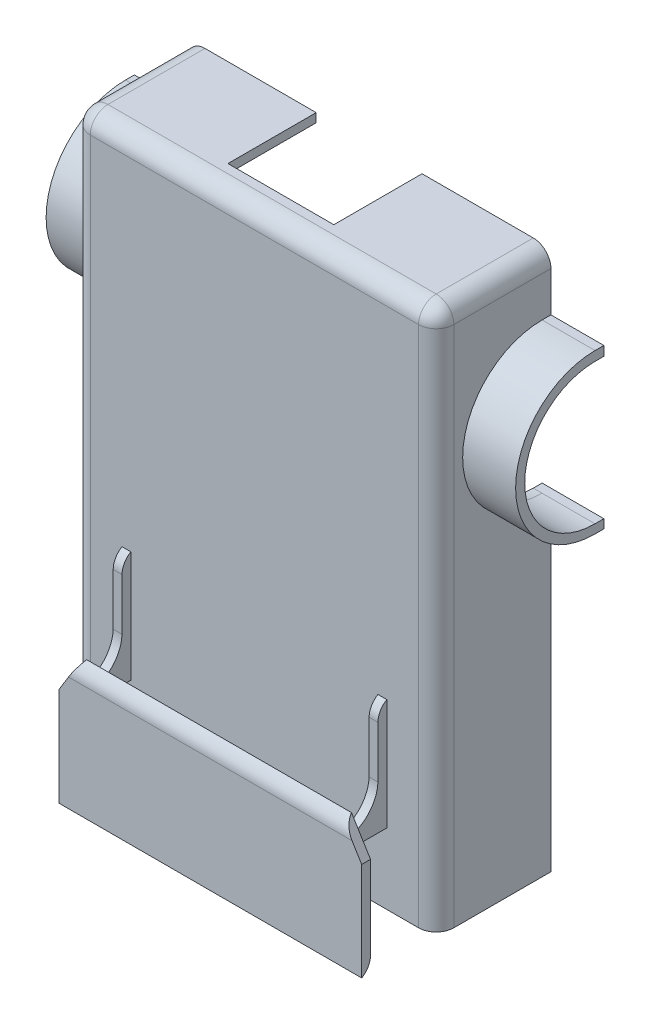
from build123d import *

# Parameters (mm, degrees)
SKETCH1_W               = 206
SKETCH1_H               = 306
BOSS_EXTRUDE2_DEPTH     = 5
SKETCH2_W               = 206
SKETCH2_H               = 306
SKETCH2_W_2             = 196
SKETCH2_H_2             = 296
BOSS_EXTRUDE3_DEPTH     = 60
SKETCH3_W               = 5
SKETCH3_H               = 198
BOSS_EXTRUDE4_DEPTH     = 60
SKETCH10_W              = 60
SKETCH10_H              = 5
CUT_EXTRUDE3_DEPTH      = 50
CUT_EXTRUDE4_DEPTH      = 296.372645991
CUT_EXTRUDE4_DEPTH_BACK = 5
BOSS_EXTRUDE6_DEPTH     = 30
CUT_EXTRUDE5_DEPTH      = 318.025235589
CUT_EXTRUDE5_DEPTH_BACK = 5
BOSS_EXTRUDE7_DEPTH     = 30
SKETCH16_W              = 5
SKETCH16_H              = 63
BOSS_EXTRUDE8_DEPTH     = 5
BOSS_EXTRUDE10_DEPTH    = 150
SKETCH19_W              = 140
SKETCH19_H              = 20
CUT_EXTRUDE6_DEPTH      = 70
BOSS_EXTRUDE11_DEPTH    = 5
FILLET3_R               = 10
FILLET4_R               = 10
FILLET5_R               = 10
FILLET6_R               = 10
FILLET7_R               = 10
FILLET8_R               = 10
FILLET9_R               = 10


with BuildPart() as part:
    # Sketch1 → Boss-Extrude2 (new body)
    with BuildSketch(Plane.XY):
        with Locations((0, 50)):
            Rectangle(SKETCH1_W, SKETCH1_H)
    extrude(amount=BOSS_EXTRUDE2_DEPTH)

    # Sketch2 → Boss-Extrude3 (add)
    with BuildSketch(Plane(origin=(0, 0, 0), x_dir=(-1, 0, 0), z_dir=(0, 0, -1))):
        with Locations((0, 50)):
            Rectangle(SKETCH2_W, SKETCH2_H)
        with Locations((0, 50)):
            Rectangle(SKETCH2_W_2, SKETCH2_H_2, mode=Mode.SUBTRACT)
    extrude(amount=BOSS_EXTRUDE3_DEPTH)

    # Sketch3 → Boss-Extrude4 (add)
    with BuildSketch(Plane(origin=(0, 0, 0), x_dir=(-1, 0, 0), z_dir=(0, 0, -1))):
        with Locations((-52.5, 1)):
            Rectangle(SKETCH3_W, SKETCH3_H)
        with Locations((52.5, 1)):
            Rectangle(SKETCH3_W, SKETCH3_H)
    extrude(amount=BOSS_EXTRUDE4_DEPTH)

    # Sketch10 → Cut-Extrude3 (cut)
    with BuildSketch(Plane(origin=(0, 0, -60), x_dir=(-1, 0, 0), z_dir=(0, 0, -1))):
        with Locations((0, 200.5)):
            Rectangle(SKETCH10_W, SKETCH10_H)
    extrude(amount=-CUT_EXTRUDE3_DEPTH, mode=Mode.SUBTRACT)

    # Sketch11 → Cut-Extrude4 (cut, two sides: drawn at the far end of the back side and taken through both)
    with BuildSketch(Plane(origin=(103, 0, 0), x_dir=(0, 0, -1), z_dir=(1, 0, 0)).offset(-CUT_EXTRUDE4_DEPTH_BACK)):
        with BuildLine():
            Line((55, 165.246993189), (60, 165.246993189))
            Line((60, 165.246993189), (60, 85.246993189))
            Line((60, 85.246993189), (55, 85.246993189))
            ThreePointArc((55, 85.246993189), (15, 125.246993189), (55, 165.246993189))
        make_face()
    extrude(amount=CUT_EXTRUDE4_DEPTH + CUT_EXTRUDE4_DEPTH_BACK, mode=Mode.SUBTRACT)

    # Sketch12 → Boss-Extrude6 (add)
    with BuildSketch(Plane(origin=(103, 0, 0), x_dir=(0, 0, -1), z_dir=(1, 0, 0))):
        with BuildLine():
            Line((55, 170.246993189), (60, 170.246993189))
            Line((60, 170.246993189), (60, 164.922358247))
            Line((60, 164.922358247), (55, 164.922358247))
            ThreePointArc((55, 164.922358247), (15.162317471, 125.084675718), (55, 85.246993189))
            Line((55, 85.246993189), (60, 85.246993189))
            Line((60, 85.246993189), (60, 80.246993189))
            Line((60, 80.246993189), (55, 80.246993189))
            ThreePointArc((55, 80.246993189), (10, 125.246993189), (55, 170.246993189))
        make_face()
    extrude(amount=BOSS_EXTRUDE6_DEPTH)

    # Sketch13 → Cut-Extrude5 (cut, two sides: drawn at the far end of the back side and taken through both)
    with BuildSketch(Plane.ZY.offset(103).offset(-CUT_EXTRUDE5_DEPTH_BACK)):
        with BuildLine():
            Line((-55, 165), (-60, 165))
            Line((-60, 165), (-60, 85))
            Line((-60, 85), (-55, 85))
            ThreePointArc((-55, 85), (-15, 125), (-55, 165))
        make_face()
    extrude(amount=CUT_EXTRUDE5_DEPTH + CUT_EXTRUDE5_DEPTH_BACK, mode=Mode.SUBTRACT)

    # Sketch14 → Boss-Extrude7 (add)
    with BuildSketch(Plane.ZY.offset(103)):
        with BuildLine():
            Line((-55, 170), (-60, 170))
            Line((-60, 170), (-60, 165))
            Line((-60, 165), (-55, 165))
            ThreePointArc((-55, 165), (-15, 125), (-55, 85))
            Line((-55, 85), (-60, 85))
            Line((-60, 85), (-60, 80))
            Line((-60, 80), (-55, 80))
            ThreePointArc((-55, 80), (-10, 125), (-55, 170))
        make_face()
    extrude(amount=BOSS_EXTRUDE7_DEPTH)

    # Sketch16 → Boss-Extrude8 (add)
    with BuildSketch(Plane.XY.offset(5)):
        with Locations((-72.5, -31.5)):
            Rectangle(SKETCH16_W, SKETCH16_H)
        with Locations((72.5, -31.5)):
            Rectangle(SKETCH16_W, SKETCH16_H)
    extrude(amount=BOSS_EXTRUDE8_DEPTH)

    # Sketch17 → Boss-Extrude10 (add)
    with BuildSketch(Plane.ZY.offset(75)):
        with BuildLine():
            Line((5, -63), (30, -63))
            Line((30, -63), (30, -57.184020249))
            ThreePointArc((30, -57.184020249), (16.143353283, -51.612696786), (10, -38))
            Line((10, -38), (10, 0))
            Line((10, 0), (5, 0))
            Line((5, 0), (5, -63))
        make_face()
    extrude(amount=-BOSS_EXTRUDE10_DEPTH)

    # Sketch19 → Cut-Extrude6 (cut)
    with BuildSketch(Plane.XZ.offset(63)):
        with Locations((0, 15)):
            Rectangle(SKETCH19_W, SKETCH19_H)
    extrude(amount=-CUT_EXTRUDE6_DEPTH, mode=Mode.SUBTRACT)

    # Sketch20 → Boss-Extrude11 (add)
    with BuildSketch(Plane.XY.offset(30)):
        Polygon((75, -45.439640401), (-75, -45.439640401), (-85.792774028, -63), (-85.792774028, -118.716663175), (85.792774028, -118.716663175), (85.792774028, -63), align=None)
    extrude(amount=-BOSS_EXTRUDE11_DEPTH)

    # Fillet3
    fillet3_edges = [part.edges().sort_by_distance(p)[0] for p in [
        (-103, 203, -27.5),
    ]]
    fillet(fillet3_edges, radius=FILLET3_R)

    # Fillet4
    fillet4_edges = [part.edges().sort_by_distance(p)[0] for p in [
        (103, 203, -27.5),
    ]]
    fillet(fillet4_edges, radius=FILLET4_R)

    # Fillet5
    # the kernel refuses this fillet: 10 mm, written as the material it takes off along each edge
    with BuildSketch(Plane(origin=(96.650635095, -45.439640401, 30), x_dir=(0, 0, -1), z_dir=(-1, 0, 0))) as fillet5_piece_1:
        with BuildLine():
            CenterArc((10, 8.660254038), FILLET5_R, 180, 60)
            Line((0, 8.660254038), (-0.2, 8.660254038))
            Line((-0.2, 8.660254038), (-0.2, 0))
            Line((-0.2, 0), (0, -0.2))
            ThreePointArc((0, -0.2), (2.5, -0.2), (4.9, -0.173205081))
            Line((4.9, -0.173205081), (5, 0))
        make_face()
    extrude(amount=193.301270189, mode=Mode.SUBTRACT)

    # Fillet6
    # the kernel refuses this fillet: 10 mm, written as the material it takes off along each edge
    with BuildSketch(Plane(origin=(-107.443409123, -118.716663175, 25), x_dir=(0, 1, 0), z_dir=(1, 0, 0))) as fillet6_piece_1:
        with BuildLine():
            CenterArc((8.660254038, 10), FILLET6_R, 210, 60)
            Line((0, 5), (-0.173205081, 4.9))
            ThreePointArc((-0.173205081, 4.9), (-0.2, 2.5), (-0.2, 0))
            Line((-0.2, 0), (0, -0.2))
            Line((0, -0.2), (8.660254038, -0.2))
            Line((8.660254038, -0.2), (8.660254038, 0))
        make_face()
    extrude(amount=214.886818246, mode=Mode.SUBTRACT)

    # Fillet7
    # the kernel refuses this fillet: 10 mm, written as the material it takes off along each edge
    with BuildSketch(Plane(origin=(-96.650635095, 0, 10), x_dir=(0, 0, -1), z_dir=(1, 0, 0))) as fillet7_piece_1:
        with BuildLine():
            CenterArc((10, -8.660254038), FILLET7_R, 120, 60)
            Line((0, -8.660254038), (-0.2, -8.660254038))
            Line((-0.2, -8.660254038), (-0.2, 0))
            Line((-0.2, 0), (0, 0.2))
            ThreePointArc((0, 0.2), (2.5, 0.2), (4.9, 0.173205081))
            Line((4.9, 0.173205081), (5, 0))
        make_face()
    extrude(amount=48.301270189, mode=Mode.SUBTRACT)

    # Fillet8
    # the kernel refuses this fillet: 10 mm, written as the material it takes off along each edge
    with BuildSketch(Plane(origin=(48.349364905, 0, 10), x_dir=(0, 0, -1), z_dir=(1, 0, 0))) as fillet8_piece_1:
        with BuildLine():
            CenterArc((10, -8.660254038), FILLET8_R, 120, 60)
            Line((0, -8.660254038), (-0.2, -8.660254038))
            Line((-0.2, -8.660254038), (-0.2, 0))
            Line((-0.2, 0), (0, 0.2))
            ThreePointArc((0, 0.2), (2.5, 0.2), (4.9, 0.173205081))
            Line((4.9, 0.173205081), (5, 0))
        make_face()
    extrude(amount=48.301270189, mode=Mode.SUBTRACT)

    # Fillet9
    # the kernel refuses this fillet: 10 mm, written as the material it takes off along each edge
    with BuildSketch(Plane(origin=(103, 193, 5), x_dir=(-1, 0, 0), z_dir=(0, -1, 0)), Plane(origin=(-103, -128, 5), x_dir=(1, 0, 0), z_dir=(0, 1, 0))) as fillet9_piece_1:
        with BuildLine():
            CenterArc((FILLET9_R, FILLET9_R), FILLET9_R, 180, 90)
            Line((0, FILLET9_R), (0, 0))
            Line((0, 0), (FILLET9_R, 0))
        make_face()
    extrude(amount=321, mode=Mode.SUBTRACT)
    with BuildSketch(Plane(origin=(-93, 193, 5), x_dir=(-1, 0, 0), z_dir=(0, -1, 0))) as fillet9_piece_2:
        with BuildLine():
            CenterArc((10 - FILLET9_R, FILLET9_R), FILLET9_R, 270, 90)
            Line((10, FILLET9_R), (10, 0))
            Line((10, 0), (10 - FILLET9_R, 0))
        make_face()
    revolve(axis=Axis((-93, 193, 5), (0, 0, -1)), revolution_arc=90, mode=Mode.SUBTRACT)
    with BuildSketch(Plane(origin=(-93, 203, 5), x_dir=(0, -1, 0), z_dir=(1, 0, 0))) as fillet9_piece_3:
        with BuildLine():
            CenterArc((FILLET9_R, FILLET9_R), FILLET9_R, 180, 90)
            Line((0, FILLET9_R), (0, 0))
            Line((0, 0), (FILLET9_R, 0))
        make_face()
    extrude(amount=186, mode=Mode.SUBTRACT)
    with BuildSketch(Plane(origin=(93, 193, 5), x_dir=(0, 1, 0), z_dir=(-1, 0, 0))) as fillet9_piece_4:
        with BuildLine():
            CenterArc((10 - FILLET9_R, FILLET9_R), FILLET9_R, 270, 90)
            Line((10, FILLET9_R), (10, 0))
            Line((10, 0), (10 - FILLET9_R, 0))
        make_face()
    revolve(axis=Axis((93, 193, 5), (0, 0, -1)), revolution_arc=90, mode=Mode.SUBTRACT)


solid = part.part
